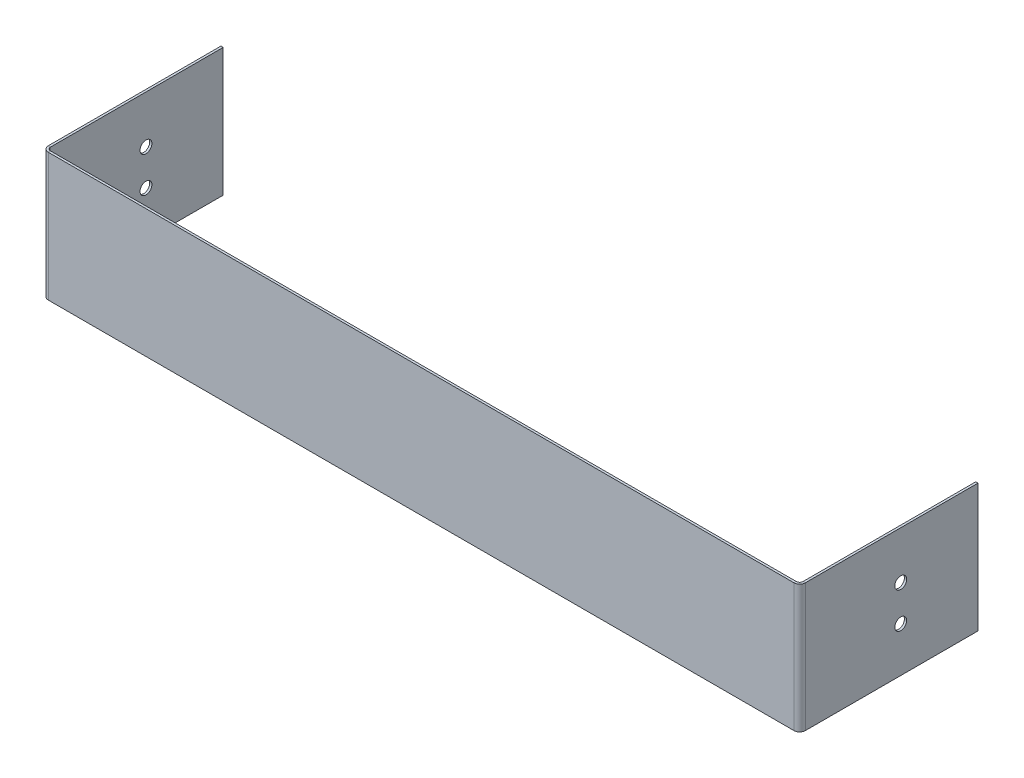
from build123d import *

# Parameters (mm, degrees)
SKETCH1_W                    = 161.729977966
SKETCH1_H                    = 27.354597718
BASE_FLANGE1_DEPTH           = 0.4826
EDGE_FLANGE1_STRIP_W         = 3.4036
EDGE_FLANGE1_STRIP_H         = 0.4826
EDGE_FLANGE1_STRIP_CUT_DEPTH = 27.354597718
EDGE_FLANGE1_DEPTH           = 27.354597718
EDGE_FLANGE2_STRIP_W         = 3.4036
EDGE_FLANGE2_STRIP_H         = 0.4826
EDGE_FLANGE2_STRIP_CUT_DEPTH = 27.354597718
EDGE_FLANGE2_DEPTH           = 27.354597718
SKETCH12_R                   = 1.27
CUT_EXTRUDE1_DEPTH           = 169.393793797


# Sheet-metal steps are written as plain solids
with BuildPart() as part:
    # Sketch1 → Base-Flange1 (new body)
    with BuildSketch(Plane.XY):
        with Locations((80.864988983, 13.677298859)):
            Rectangle(SKETCH1_W, SKETCH1_H)
    extrude(amount=-BASE_FLANGE1_DEPTH)

    # Edge-Flange1 strip (across the edge) → Edge-Flange1 strip cut (cut)
    with BuildSketch(Plane(origin=(161.729977966, 27.354597718, -0.4826), x_dir=(-1, 0, 0), z_dir=(0, -1, 0))):
        with Locations((-0.4826, -0.2413)):
            Rectangle(EDGE_FLANGE1_STRIP_W, EDGE_FLANGE1_STRIP_H)
    extrude(amount=EDGE_FLANGE1_STRIP_CUT_DEPTH, mode=Mode.SUBTRACT)

    # Edge-Flange1 section (across the edge) → Edge-Flange1 (add)
    with BuildSketch(Plane(origin=(161.729977966, 27.354597718, -0.4826), x_dir=(-1, 0, 0), z_dir=(0, -1, 0))):
        with BuildLine():
            Line((0, 0.7366), (0, 37.6174))
            Line((0, 37.6174), (0.4826, 37.6174))
            Line((0.4826, 37.6174), (0.4826, 0.7366))
            ThreePointArc((0.4826, 0.7366), (0.698345145, 0.215745145), (1.2192, 0))
            Line((1.2192, 0), (1.2192, -0.4826))
            ThreePointArc((1.2192, -0.4826), (0.357095412, -0.125504588), (0, 0.7366))
        make_face()
    extrude(amount=EDGE_FLANGE1_DEPTH)

    # Edge-Flange2 strip (across the edge) → Edge-Flange2 strip cut (cut)
    with BuildSketch(Plane(origin=(0, 0, -0.4826), x_dir=(1, 0, 0), z_dir=(0, 1, 0))):
        with Locations((-0.4826, -0.2413)):
            Rectangle(EDGE_FLANGE2_STRIP_W, EDGE_FLANGE2_STRIP_H)
    extrude(amount=EDGE_FLANGE2_STRIP_CUT_DEPTH, mode=Mode.SUBTRACT)

    # Edge-Flange2 section (across the edge) → Edge-Flange2 (add)
    with BuildSketch(Plane(origin=(0, 0, -0.4826), x_dir=(1, 0, 0), z_dir=(0, 1, 0))):
        with BuildLine():
            Line((0, 0.7366), (0, 37.6174))
            Line((0, 37.6174), (0.4826, 37.6174))
            Line((0.4826, 37.6174), (0.4826, 0.7366))
            ThreePointArc((0.4826, 0.7366), (0.698345145, 0.215745145), (1.2192, 0))
            Line((1.2192, 0), (1.2192, -0.4826))
            ThreePointArc((1.2192, -0.4826), (0.357095412, -0.125504588), (0, 0.7366))
        make_face()
    extrude(amount=EDGE_FLANGE2_DEPTH)

    # Sketch12 → Cut-Extrude1 (cut, through all)
    with BuildSketch(Plane(origin=(161.729977966, 0, 0), x_dir=(0, 0, -1), z_dir=(1, 0, 0))):
        with Locations((21.59, 17.194597718)):
            Circle(SKETCH12_R)
        with Locations((21.59, 9.574597718)):
            Circle(SKETCH12_R)
    extrude(amount=-CUT_EXTRUDE1_DEPTH, mode=Mode.SUBTRACT)


solid = part.part
